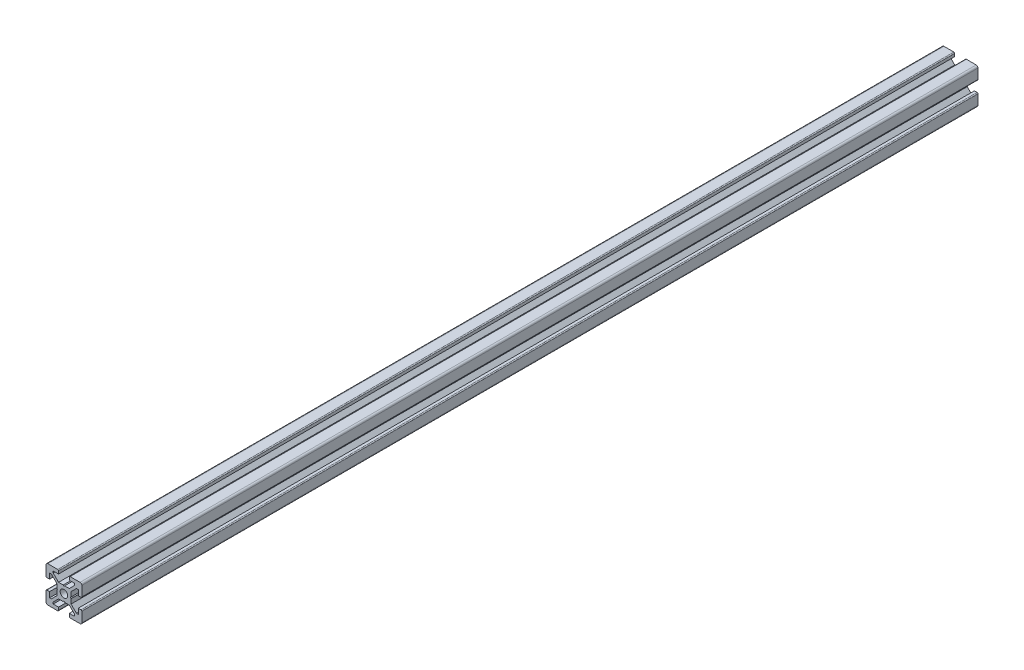
from build123d import *

# Parameters (mm, degrees)
SCHIZZO1_R                    = 2.1
ESTRUSIONE_ESTRUSIONE1_DEPTH  = 500
TAGLIO_ESTRUSIONE5_DEPTH      = 501.49975025
TAGLIO_ESTRUSIONE5_DEPTH_BACK = 501.49975025
SCHIZZO2_R                    = 3


with BuildPart() as part:
    # Schizzo1 → Estrusione-Estrusione1 (new body)
    with BuildSketch(Plane.XY):
        with BuildLine():
            Line((-3.6, 0), (-4, 0.4))
            Line((-4, 0.4), (-4, 3))
            Line((-4, 3), (-7, 6))
            Line((-7, 6), (-8, 6))
            Line((-8, 6), (-8, 3))
            Line((-8, 3), (-9.5, 3))
            ThreePointArc((-9.5, 3), (-9.853553391, 3.146446609), (-10, 3.5))
            Line((-10, 3.5), (-10, 9))
            ThreePointArc((-10, 9), (-9.707106781, 9.707106781), (-9, 10))
            Line((-9, 10), (-3.5, 10))
            ThreePointArc((-3.5, 10), (-3.146446609, 9.853553391), (-3, 9.5))
            Line((-3, 9.5), (-3, 8))
            Line((-3, 8), (-6, 8))
            Line((-6, 8), (-6, 7))
            Line((-6, 7), (-3, 4))
            Line((-3, 4), (-0.4, 4))
            Line((-0.4, 4), (0, 3.6))
            Line((0, 3.6), (0.4, 4))
            Line((0.4, 4), (3, 4))
            Line((3, 4), (6, 7))
            Line((6, 7), (6, 8))
            Line((6, 8), (3, 8))
            Line((3, 8), (3, 9.5))
            ThreePointArc((3, 9.5), (3.146446609, 9.853553391), (3.5, 10))
            Line((3.5, 10), (9, 10))
            ThreePointArc((9, 10), (9.707106781, 9.707106781), (10, 9))
            Line((10, 9), (10, 3.5))
            ThreePointArc((10, 3.5), (9.853553391, 3.146446609), (9.5, 3))
            Line((9.5, 3), (8, 3))
            Line((8, 3), (8, 6))
            Line((8, 6), (7, 6))
            Line((7, 6), (4, 3))
            Line((4, 3), (4, 0.4))
            Line((4, 0.4), (3.6, 0))
            Line((3.6, 0), (4, -0.4))
            Line((4, -0.4), (4, -3))
            Line((4, -3), (7, -6))
            Line((7, -6), (8, -6))
            Line((8, -6), (8, -3))
            Line((8, -3), (9.5, -3))
            ThreePointArc((9.5, -3), (9.853553391, -3.146446609), (10, -3.5))
            Line((10, -3.5), (10, -9))
            ThreePointArc((10, -9), (9.707106781, -9.707106781), (9, -10))
            Line((9, -10), (3.5, -10))
            ThreePointArc((3.5, -10), (3.146446609, -9.853553391), (3, -9.5))
            Line((3, -9.5), (3, -8))
            Line((3, -8), (6, -8))
            Line((6, -8), (6, -7))
            Line((6, -7), (3, -4))
            Line((3, -4), (0.4, -4))
            Line((0.4, -4), (0, -3.6))
            Line((0, -3.6), (-0.4, -4))
            Line((-0.4, -4), (-3, -4))
            Line((-3, -4), (-6, -7))
            Line((-6, -7), (-6, -8))
            Line((-6, -8), (-3, -8))
            Line((-3, -8), (-3, -9.5))
            ThreePointArc((-3, -9.5), (-3.146446609, -9.853553391), (-3.5, -10))
            Line((-3.5, -10), (-9, -10))
            ThreePointArc((-9, -10), (-9.707106781, -9.707106781), (-10, -9))
            Line((-10, -9), (-10, -3.5))
            ThreePointArc((-10, -3.5), (-9.853553391, -3.146446609), (-9.5, -3))
            Line((-9.5, -3), (-8, -3))
            Line((-8, -3), (-8, -6))
            Line((-8, -6), (-7, -6))
            Line((-7, -6), (-4, -3))
            Line((-4, -3), (-4, -0.4))
            Line((-4, -0.4), (-3.6, 0))
        make_face()
        Circle(SCHIZZO1_R, mode=Mode.SUBTRACT)
    extrude(amount=ESTRUSIONE_ESTRUSIONE1_DEPTH)

    # Schizzo2 → Taglio-Estrusione5 (cut, two sides: drawn at the far end of the back side and taken through both)
    with BuildSketch(Plane.ZY.offset(10).offset(-TAGLIO_ESTRUSIONE5_DEPTH_BACK)):
        with Locations((25, 0)):
            Circle(SCHIZZO2_R)
        with Locations((475, 0)):
            Circle(SCHIZZO2_R)
    extrude(amount=TAGLIO_ESTRUSIONE5_DEPTH + TAGLIO_ESTRUSIONE5_DEPTH_BACK, mode=Mode.SUBTRACT)


solid = part.part
